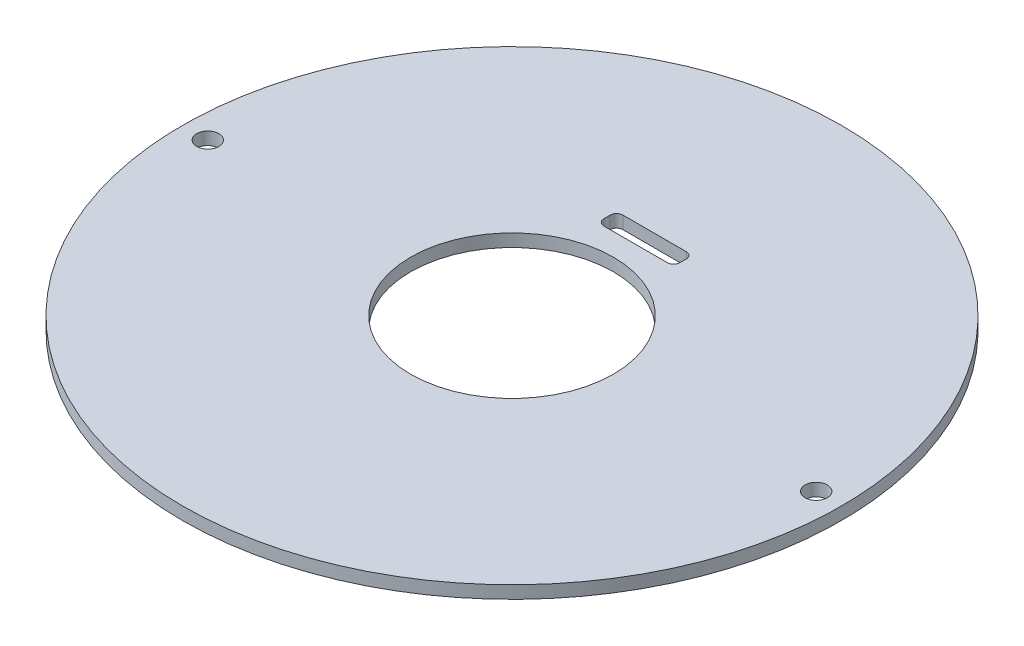
from build123d import *

# Parameters (mm, degrees)
SKETCH1_R           = 52
SKETCH1_R_2         = 16
SKETCH1_R_3         = 1.75
BOSS_EXTRUDE1_DEPTH = 2
SKETCH2_W           = 12
SKETCH2_H           = 3
CUT_EXTRUDE1_DEPTH  = 74.566296631
FILLET1_R           = 1


with BuildPart() as part:
    # Sketch1 → Boss-Extrude1 (new body)
    with BuildSketch(Plane(origin=(0, 0, 0), x_dir=(1, 0, 0), z_dir=(0, 1, 0))):
        Circle(SKETCH1_R)
        Circle(SKETCH1_R_2, mode=Mode.SUBTRACT)
        with Locations((-48, 0)):
            Circle(SKETCH1_R_3, mode=Mode.SUBTRACT)
        with Locations((48, 0)):
            Circle(SKETCH1_R_3, mode=Mode.SUBTRACT)
    extrude(amount=BOSS_EXTRUDE1_DEPTH)

    # Sketch2 → Cut-Extrude1 (cut, through all)
    with BuildSketch(Plane(origin=(0, 2, 0), x_dir=(1, 0, 0), z_dir=(0, 1, 0))):
        with Locations((0, 21)):
            Rectangle(SKETCH2_W, SKETCH2_H)
    extrude(amount=-CUT_EXTRUDE1_DEPTH, mode=Mode.SUBTRACT)

    # Fillet1
    fillet1_edges = [part.edges().sort_by_distance(p)[0] for p in [
        (-6, 1, -19.5),
        (6, 1, -22.5),
        (6, 1, -19.5),
        (-6, 1, -22.5),
    ]]
    fillet(fillet1_edges, radius=FILLET1_R)


solid = part.part
